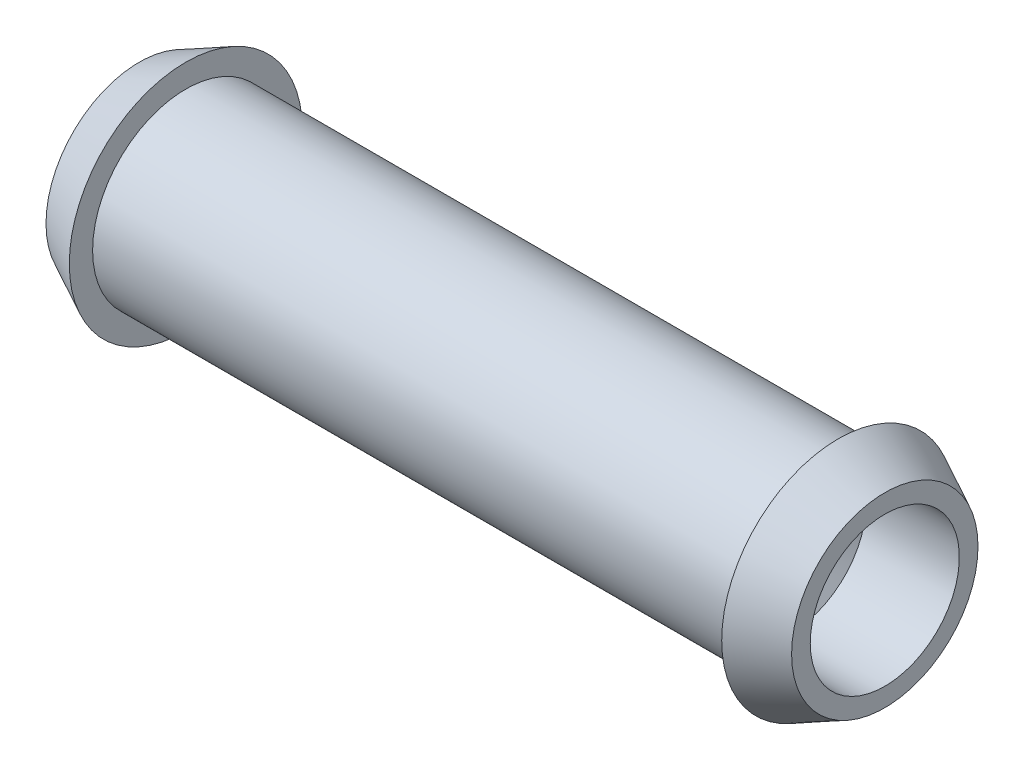
from build123d import *

# Parameters (mm, degrees)
SKETCH1_W = 40
SKETCH1_H = 5
SKETCH2_W = 3.5
SKETCH2_H = 6


with BuildPart() as part:
    # Sketch1 → Base-Revolve (revolve)
    with BuildSketch(Plane.XY):
        with Locations((0, 2.5)):
            Rectangle(SKETCH1_W, SKETCH1_H)
    revolve(axis=Axis((-30, 0, 0), (1, 0, 0)))

    # Sketch2 → Cut-to-GripLength (revolve, cut)
    with BuildSketch(Plane.XY):
        with Locations((-19.25, 3)):
            Rectangle(SKETCH2_W, SKETCH2_H)
        with Locations((19.25, 3)):
            Rectangle(SKETCH2_W, SKETCH2_H)
    revolve(axis=Axis((-30, 0, 0), (1, 0, 0)), mode=Mode.SUBTRACT)

    # Sketch3 → HeadTypeA (revolve)
    with BuildSketch(Plane.XY):
        Polygon((-20, 5), (-20, 0), (-17.5, 0), (-17.5, 6.25), align=None)
        Polygon((20, 5), (17.5, 6.25), (17.5, 0), (20, 0), align=None)
    revolve(axis=Axis((-23, 0, 0), (1, 0, 0)))

    # Sketch5 → HoleTypeA (revolve, cut)
    with BuildSketch(Plane.XY):
        Polygon((-12.690598923, 0), (-15, 4), (-20, 4), (-20, 0), align=None)
        Polygon((12.690598923, 0), (15, 4), (20, 4), (20, 0), align=None)
    revolve(axis=Axis((-22, 0, 0), (1, 0, 0)), mode=Mode.SUBTRACT)


solid = part.part
